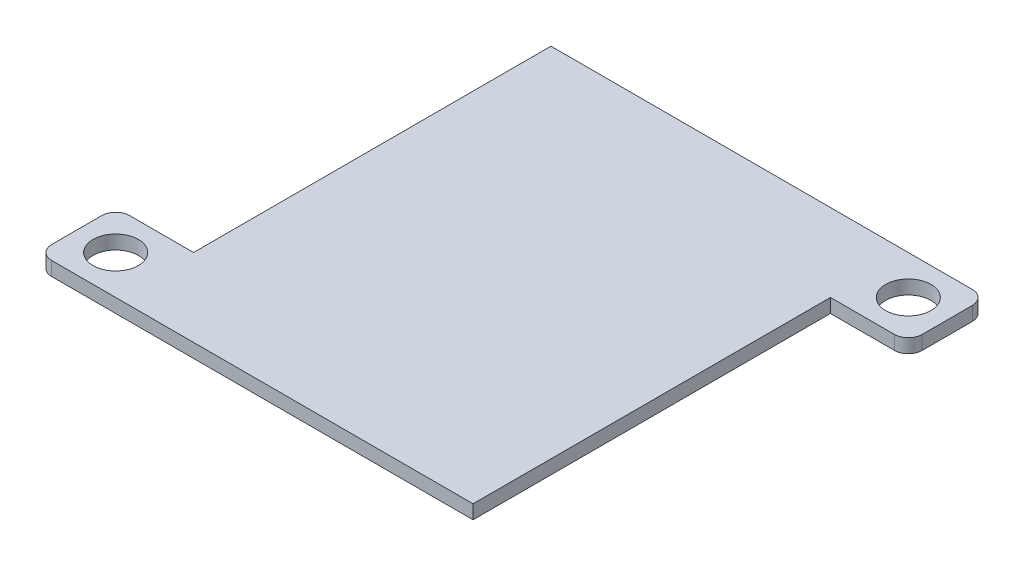
from build123d import *

# Parameters (mm, degrees)
SKETCH1_R           = 1.63
BOSS_EXTRUDE1_DEPTH = 1
FILLET1_R           = 1


with BuildPart() as part:
    # Sketch1 → Boss-Extrude1 (new body)
    with BuildSketch(Plane(origin=(0, 0, 0), x_dir=(1, 0, 0), z_dir=(0, 1, 0))):
        Polygon((12.963481568, -15.78820907), (-13.296518432, -15.78820907), (-18.336518432, -15.78820907), (-18.336518432, -10.18820907), (-12.736518432, -10.18820907), (-12.736518432, 15.51179093), (12.963481568, 15.51179093), (18.563481568, 15.51179093), (18.563481568, 9.91179093), (12.963481568, 9.91179093), align=None)
        with Locations((15.763481568, 12.71179093)):
            Circle(SKETCH1_R, mode=Mode.SUBTRACT)
        with Locations((-15.536518432, -12.98820907)):
            Circle(SKETCH1_R, mode=Mode.SUBTRACT)
    extrude(amount=BOSS_EXTRUDE1_DEPTH)

    # Fillet1
    fillet1_edges = [part.edges().sort_by_distance(p)[0] for p in [
        (-18.336518432, 0.5, 10.18820907),
        (-18.336518432, 0.5, 15.78820907),
        (18.563481568, 0.5, -15.51179093),
        (18.563481568, 0.5, -9.91179093),
    ]]
    fillet(fillet1_edges, radius=FILLET1_R)


solid = part.part
